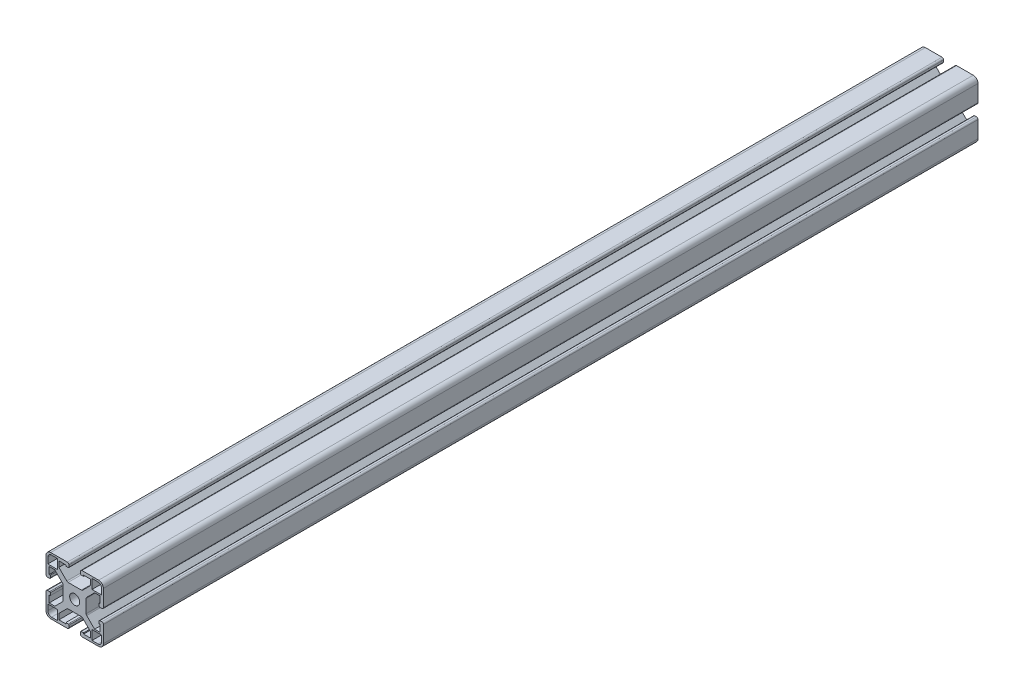
from build123d import *

# Parameters (mm, degrees)
BOSS_EXTRUDE1_DEPTH = 304.8
MIRROR3_START       = -304.8
MIRROR3_DEPTH       = 609.6


# Read off the part's stored shape, not the designer's step: Mirror3
with BuildPart() as part:
    # Sketch3 → Boss-Extrude1 (new, symmetric)
    with BuildSketch(Plane.XY):
        with BuildLine():
            Line((0, 8), (0, 3.5))
            ThreePointArc((0, 3.5), (-2.474873734, 2.474873734), (-3.5, 0))
            Line((-3.5, 0), (-8, 0))
            Line((-8, 0), (-8, 4.600266817))
            ThreePointArc((-8, 4.600266817), (-8.096672994, 5.086274776), (-8.371974388, 5.498292429))
            Line((-8.371974388, 5.498292429), (-13.873681959, 11))
            Line((-13.873681959, 11), (-17.7902, 11))
            Line((-17.7902, 11), (-17.7902, 6.2098))
            Line((-17.7902, 6.2098), (-17.0282, 6.2098))
            Line((-17.0282, 6.2098), (-17.0282, 4.508))
            ThreePointArc((-17.0282, 4.508), (-17.176989755, 4.148789755), (-17.5362, 4))
            Line((-17.5362, 4), (-18.8951, 4))
            ThreePointArc((-18.8951, 4), (-19.676382283, 4.323617717), (-20, 5.1049))
            Line((-20, 5.1049), (-20, 16.68))
            ThreePointArc((-20, 16.68), (-19.027594514, 19.027594514), (-16.68, 20))
            Line((-16.68, 20), (-5.1049, 20))
            ThreePointArc((-5.1049, 20), (-4.323617717, 19.676382283), (-4, 18.8951))
            Line((-4, 18.8951), (-4, 17.5362))
            ThreePointArc((-4, 17.5362), (-4.148789755, 17.176989755), (-4.508, 17.0282))
            Line((-4.508, 17.0282), (-6.2098, 17.0282))
            Line((-6.2098, 17.0282), (-6.2098, 17.7902))
            Line((-6.2098, 17.7902), (-11, 17.7902))
            Line((-11, 17.7902), (-11, 13.873681959))
            Line((-11, 13.873681959), (-5.498292429, 8.371974388))
            ThreePointArc((-5.498292429, 8.371974388), (-5.086274776, 8.096672994), (-4.600266817, 8))
            Line((-4.600266817, 8), (0, 8))
        make_face()
        with BuildLine():
            Line((-12.065, 18.73), (-12.065, 12.065))
            Line((-12.065, 12.065), (-18.73, 12.065))
            Line((-18.73, 12.065), (-18.73, 16.19))
            ThreePointArc((-18.73, 16.19), (-17.986051224, 17.986051224), (-16.19, 18.73))
            Line((-16.19, 18.73), (-12.065, 18.73))
        make_face(mode=Mode.SUBTRACT)
    extrude(amount=BOSS_EXTRUDE1_DEPTH, both=True)

    # Mirror1: part across plane


with BuildPart() as part_1:
    add(part.part)
    add(part.part.mirror(Plane(origin=(0, 0, 304.8), x_dir=(0, 0, 1), z_dir=(1, 0, 0))))

    # Mirror3 outline → Mirror3 (add)
    with BuildSketch(Plane.XY.offset(MIRROR3_START)):
        with BuildLine():
            Line((-8, 0), (-8, -4.600266817))
            ThreePointArc((-8, -4.600266817), (-8.096672994, -5.086274776), (-8.371974388, -5.498292429))
            Line((-8.371974388, -5.498292429), (-13.873681959, -11))
            Line((-13.873681959, -11), (-17.7902, -11))
            Line((-17.7902, -11), (-17.7902, -6.2098))
            Line((-17.7902, -6.2098), (-17.0282, -6.2098))
            Line((-17.0282, -6.2098), (-17.0282, -4.508))
            ThreePointArc((-17.0282, -4.508), (-17.176989755, -4.148789755), (-17.5362, -4))
            Line((-17.5362, -4), (-18.8951, -4))
            ThreePointArc((-18.8951, -4), (-19.676382283, -4.323617717), (-20, -5.1049))
            Line((-20, -5.1049), (-20, -16.68))
            ThreePointArc((-20, -16.68), (-19.027594514, -19.027594514), (-16.68, -20))
            Line((-16.68, -20), (-5.1049, -20))
            ThreePointArc((-5.1049, -20), (-4.323617717, -19.676382283), (-4, -18.8951))
            Line((-4, -18.8951), (-4, -17.5362))
            ThreePointArc((-4, -17.5362), (-4.148789755, -17.176989755), (-4.508, -17.0282))
            Line((-4.508, -17.0282), (-6.2098, -17.0282))
            Line((-6.2098, -17.0282), (-6.2098, -17.7902))
            Line((-6.2098, -17.7902), (-11, -17.7902))
            Line((-11, -17.7902), (-11, -13.873681959))
            Line((-11, -13.873681959), (-5.498292429, -8.371974388))
            ThreePointArc((-5.498292429, -8.371974388), (-5.086274776, -8.096672994), (-4.600266817, -8))
            Line((-4.600266817, -8), (4.600266817, -8))
            ThreePointArc((4.600266817, -8), (5.086274776, -8.096672994), (5.498292429, -8.371974388))
            Line((5.498292429, -8.371974388), (11, -13.873681959))
            Line((11, -13.873681959), (11, -17.7902))
            Line((11, -17.7902), (6.2098, -17.7902))
            Line((6.2098, -17.7902), (6.2098, -17.0282))
            Line((6.2098, -17.0282), (4.508, -17.0282))
            ThreePointArc((4.508, -17.0282), (4.148789755, -17.176989755), (4, -17.5362))
            Line((4, -17.5362), (4, -18.8951))
            ThreePointArc((4, -18.8951), (4.323617717, -19.676382283), (5.1049, -20))
            Line((5.1049, -20), (16.68, -20))
            ThreePointArc((16.68, -20), (19.027594514, -19.027594514), (20, -16.68))
            Line((20, -16.68), (20, -5.1049))
            ThreePointArc((20, -5.1049), (19.676382283, -4.323617717), (18.8951, -4))
            Line((18.8951, -4), (17.5362, -4))
            ThreePointArc((17.5362, -4), (17.176989755, -4.148789755), (17.0282, -4.508))
            Line((17.0282, -4.508), (17.0282, -6.2098))
            Line((17.0282, -6.2098), (17.7902, -6.2098))
            Line((17.7902, -6.2098), (17.7902, -11))
            Line((17.7902, -11), (13.873681959, -11))
            Line((13.873681959, -11), (8.371974388, -5.498292429))
            ThreePointArc((8.371974388, -5.498292429), (8.096672994, -5.086274776), (8, -4.600266817))
            Line((8, -4.600266817), (8, 0))
            Line((8, 0), (3.5, 0))
            ThreePointArc((3.5, 0), (0, -3.5), (-3.5, 0))
            Line((-3.5, 0), (-8, 0))
        make_face()
        with BuildLine():
            Line((-12.065, -12.065), (-12.065, -18.73))
            Line((-12.065, -18.73), (-16.19, -18.73))
            ThreePointArc((-16.19, -18.73), (-17.986051224, -17.986051224), (-18.73, -16.19))
            Line((-18.73, -16.19), (-18.73, -12.065))
            Line((-18.73, -12.065), (-12.065, -12.065))
        make_face(mode=Mode.SUBTRACT)
        with BuildLine():
            Line((12.065, -18.73), (12.065, -12.065))
            Line((12.065, -12.065), (18.73, -12.065))
            Line((18.73, -12.065), (18.73, -16.19))
            ThreePointArc((18.73, -16.19), (17.986051224, -17.986051224), (16.19, -18.73))
            Line((16.19, -18.73), (12.065, -18.73))
        make_face(mode=Mode.SUBTRACT)
    extrude(amount=MIRROR3_DEPTH)


solid = part_1.part
